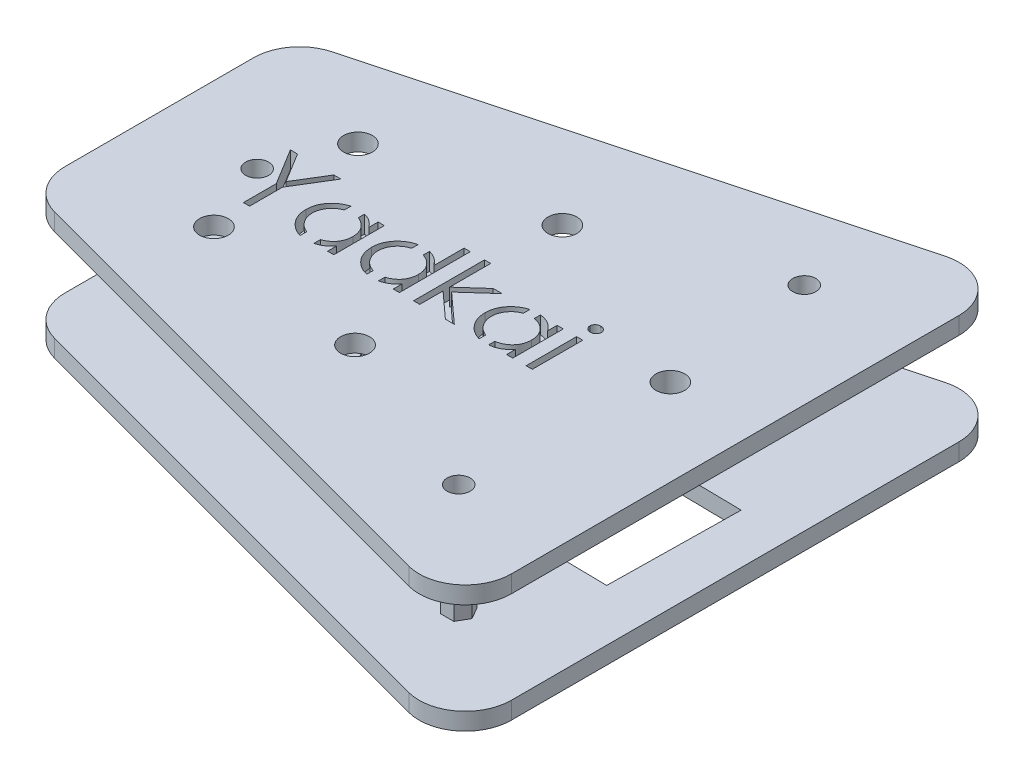
from build123d import *

# Parameters (mm, degrees)
CROQUIS1_R                = 2.5
CROQUIS1_R_2              = 2
SALIENTE_EXTRUIR1_DEPTH   = 22
CROQUIS2_W                = 100
CROQUIS2_H                = 16
CORTAR_EXTRUIR1_DEPTH     = 50
SALIENTE_EXTRUIR2_DEPTH   = 16
SALIENTE_EXTRUIR2_2_DEPTH = 16
SALIENTE_EXTRUIR2_3_DEPTH = 16
SKETCH1_W                 = 1.076923076
SKETCH1_H                 = 8.769230769
CUT_EXTRUDE1_DEPTH        = 30
SKETCH2_W                 = 2.378168238
SKETCH2_H                 = 15.826158804
SKETCH2_W_2               = 2.017947427
SKETCH2_W_3               = 1.737170199
BOSS_EXTRUDE1_DEPTH       = 3
SKETCH3_W                 = 1.391698598
SKETCH3_H                 = 15.836770953
SKETCH3_W_2               = 2.136320855
SKETCH3_H_2               = 18.046858211
SKETCH3_W_3               = 2.14238319
SKETCH3_H_3               = 19.504207353
BOSS_EXTRUDE2_DEPTH       = 3
CUT_EXTRUDE4_DEPTH        = 3
SKETCH11_R                = 9.688361484
BOSS_EXTRUDE3_DEPTH       = 7
SKETCH5_R                 = 2.494533749
CUT_EXTRUDE3_DEPTH        = 23
FILLET2_R                 = 0.7


with BuildPart() as part:
    # Croquis1 → Saliente-Extruir1 (new body)
    with BuildSketch(Plane(origin=(0, 0, 0), x_dir=(1, 0, 0), z_dir=(0, 1, 0))):
        with BuildLine():
            Line((0, 16.361384096), (0, -16.361384096))
            ThreePointArc((0, -16.361384096), (1.653173278, -21.231475528), (5.929447639, -24.088790706))
            Line((5.929447639, -24.088790706), (89.929447639, -46.596522871))
            ThreePointArc((89.929447639, -46.596522871), (96.870091432, -45.215942983), (100, -38.86911626))
            Line((100, -38.86911626), (100, 38.86911626))
            ThreePointArc((100, 38.86911626), (96.870091432, 45.215942983), (89.929447639, 46.596522871))
            Line((89.929447639, 46.596522871), (5.929447639, 24.088790706))
            ThreePointArc((5.929447639, 24.088790706), (1.653173278, 21.231475528), (0, 16.361384096))
        make_face()
        with Locations((22, 12.5)):
            Circle(CROQUIS1_R, mode=Mode.SUBTRACT)
        with Locations((22, -12.5)):
            Circle(CROQUIS1_R, mode=Mode.SUBTRACT)
        with Locations((52, 18)):
            Circle(CROQUIS1_R, mode=Mode.SUBTRACT)
        with Locations((52, -18)):
            Circle(CROQUIS1_R, mode=Mode.SUBTRACT)
        with Locations((17, 0)):
            Circle(CROQUIS1_R_2, mode=Mode.SUBTRACT)
        with Locations((82, -30)):
            Circle(CROQUIS1_R_2, mode=Mode.SUBTRACT)
        with Locations((82, 30)):
            Circle(CROQUIS1_R_2, mode=Mode.SUBTRACT)
    extrude(amount=SALIENTE_EXTRUIR1_DEPTH)

    # Croquis2 → Cortar-Extruir1 (cut, symmetric)
    with BuildSketch(Plane.XY):
        with Locations((50, 11)):
            Rectangle(CROQUIS2_W, CROQUIS2_H)
    extrude(amount=CORTAR_EXTRUIR1_DEPTH, both=True, mode=Mode.SUBTRACT)


with BuildPart() as cortar_extruir1_piece_1:
    # of the separate pieces the step leaves, piece 1, a body of its own (cortar_extruir1_pieces)
    add(part.part.solids().sort_by_distance((89.929447639, 0, -46.596522871))[0])


with BuildPart() as cortar_extruir1_piece_2:
    # of the separate pieces the step leaves, piece 2, a body of its own (cortar_extruir1_pieces)
    add(part.part.solids().sort_by_distance((5.929447639, 19, -24.088790706))[0])


with BuildPart() as body_3:
    # Croquis3 → Saliente-Extruir2 (new body)
    with BuildSketch(Plane(origin=(0, 3, 0), x_dir=(1, 0, 0), z_dir=(0, 1, 0))):
        Polygon((17, -2.309401077), (19, -1.154700538), (19, 1.154700538), (17, 2.309401077), (15, 1.154700538), (15, -1.154700538), align=None)
    extrude(amount=SALIENTE_EXTRUIR2_DEPTH)


with BuildPart() as body_4:
    # Croquis3 → Saliente-Extruir2 2 (new body)
    with BuildSketch(Plane(origin=(0, 3, 0), x_dir=(1, 0, 0), z_dir=(0, 1, 0))):
        Polygon((80.845299462, -32), (83.154700538, -32), (84.309401077, -30), (83.154700538, -28), (80.845299462, -28), (79.690598923, -30), align=None)
    extrude(amount=SALIENTE_EXTRUIR2_2_DEPTH)


with BuildPart() as body_5:
    # Croquis3 → Saliente-Extruir2 3 (new body)
    with BuildSketch(Plane(origin=(0, 3, 0), x_dir=(1, 0, 0), z_dir=(0, 1, 0))):
        Polygon((84, 28.845299462), (84, 31.154700538), (82, 32.309401077), (80, 31.154700538), (80, 28.845299462), (82, 27.690598923), align=None)
    extrude(amount=SALIENTE_EXTRUIR2_3_DEPTH)


with BuildPart() as cut_extrude1_tool:
    # Sketch1 → Cut-Extrude1 (new body)
    # profile 1 of 7: a face of its own
    with BuildSketch(Plane(origin=(0, 22, 0), x_dir=(1, 0, 0), z_dir=(0, 1, 0))):
        Polygon((17.057483242, 5.717152356), (18.290656319, 5.717152356), (21.444502473, 0.560902356), (24.593540935, 5.717152356), (25.826714012, 5.717152356), (21.980560166, -0.578520721), (21.980560166, -6.282847644), (20.903637089, -6.282847644), (20.903637089, -0.578520721), align=None)
    # profile 2 of 7: a face of its own
    with BuildSketch(Plane(origin=(0, 22, 0), x_dir=(1, 0, 0), z_dir=(0, 1, 0))):
        with BuildLine():
            Line((36.595944781, 2.486383125), (36.595944781, -6.282847644))
            Line((36.595944781, -6.282847644), (35.519021704, -6.282847644))
            Line((35.519021704, -6.282847644), (35.519021704, -4.766020721))
            add(Edge.make_bspline(
                [(35.519021704, -4.766020721), (35.39758585, -4.903299329), (35.160602255, -5.171200259), (34.764804136, -5.521196279), (34.345256098, -5.810493381), (33.903994425, -6.044150235), (33.441417591, -6.219665857), (32.958551006, -6.344418402), (32.4551977, -6.424625837), (32.111475341, -6.432635055), (31.937290935, -6.436693798)],
                knots=[0, 0, 0, 0, 1.074387032, 2.096679803, 3.090159297, 4.057316773, 5.018401886, 5.985159533, 6.978961417, 8, 8, 8, 8], degree=3))
            add(Edge.make_bspline(
                [(31.937290935, -6.436693798), (31.782429379, -6.432489093), (31.477035533, -6.424197229), (31.027792983, -6.359869331), (30.595476699, -6.256564342), (30.179678165, -6.11290415), (29.783087952, -5.922341333), (29.402310477, -5.694199911), (29.03931839, -5.422517065), (28.699644543, -5.111929539), (28.386849113, -4.774575298), (28.112353321, -4.414761994), (27.883485618, -4.034045523), (27.692102485, -3.637246139), (27.544686447, -3.221309272), (27.4419197, -2.787673267), (27.37766674, -2.336850844), (27.369378304, -2.029858193), (27.36517555, -1.874193798)],
                knots=[0, 0, 0, 0, 1.033919861, 2.038935746, 3.024066025, 3.998881131, 4.97069526, 5.957263378, 6.95902576, 7.993208707, 9.027059324, 10.027763471, 11.009749337, 11.988697705, 12.965288445, 13.950418724, 14.960734635, 16, 16, 16, 16], degree=3))
            add(Edge.make_bspline(
                [(27.36517555, -1.874193798), (27.369471452, -1.721746815), (27.377964218, -1.420367352), (27.441232401, -0.977126102), (27.54762443, -0.550206351), (27.696931337, -0.140982545), (27.888389468, 0.251040484), (28.121285766, 0.626139998), (28.395637051, 0.985349361), (28.711931018, 1.320222139), (29.054564516, 1.629549959), (29.421108736, 1.898380972), (29.8024457, 2.130553025), (30.204490308, 2.314507801), (30.62129181, 2.463339017), (31.056560767, 2.566309193), (31.50848618, 2.626985723), (31.815310724, 2.635772343), (31.970944781, 2.640229279)],
                knots=[0, 0, 0, 0, 1.020392517, 2.01726096, 2.990465484, 3.961182959, 4.928053699, 5.906110375, 6.912531644, 7.948652711, 8.985773172, 9.998621852, 10.987621588, 11.969261332, 12.953316658, 13.946091881, 14.958173133, 16, 16, 16, 16], degree=3))
            add(Edge.make_bspline(
                [(31.970944781, 2.640229279), (32.149915726, 2.635299845), (32.500869303, 2.625633458), (33.014222478, 2.545189821), (33.499860688, 2.409286505), (33.961532752, 2.224426512), (34.397580819, 1.978773726), (34.803876765, 1.668899574), (35.184672708, 1.296758362), (35.405405136, 1.010916838), (35.519021704, 0.863786971)],
                knots=[0, 0, 0, 0, 1.038897134, 2.037228247, 3.008116434, 3.962042015, 4.918381754, 5.904844433, 6.921570401, 8, 8, 8, 8], degree=3))
            Line((35.519021704, 0.863786971), (35.519021704, 2.486383125))
            Line((35.519021704, 2.486383125), (36.595944781, 2.486383125))
        make_face()
        with BuildLine():
            add(Edge.make_bspline(
                [(31.985367858, 1.563306202), (31.827947271, 1.557705158), (31.517224071, 1.546649589), (31.061073207, 1.460340462), (30.624570073, 1.316736139), (30.209897818, 1.120341049), (29.82360679, 0.873385381), (29.478371347, 0.574683495), (29.171367799, 0.232385161), (28.913168036, -0.151964932), (28.702686332, -0.564004101), (28.55468508, -0.99471646), (28.457076232, -1.436333526), (28.447104161, -1.735862735), (28.442098627, -1.886213029)],
                knots=[0, 0, 0, 0, 1.031046209, 2.035121221, 3.029706178, 4.034933723, 5.034054252, 6.02443088, 7.017295772, 8.038157696, 9.050218397, 10.03989886, 11.016116709, 12, 12, 12, 12], degree=3))
            add(Edge.make_bspline(
                [(28.442098627, -1.886213029), (28.448492547, -2.035664825), (28.461255325, -2.333982617), (28.552971991, -2.776201737), (28.706845843, -3.207015596), (28.91681863, -3.622767573), (29.1797442, -4.008770203), (29.484505295, -4.35759348), (29.834049116, -4.657557783), (30.22122914, -4.908658035), (30.634742182, -5.111500964), (31.069601375, -5.2526403), (31.517632135, -5.343764119), (31.822268708, -5.35440804), (31.975752473, -5.359770721)],
                knots=[0, 0, 0, 0, 0.979072187, 1.954306742, 2.945804271, 3.96968567, 4.997920485, 5.998718438, 6.996577872, 8.005894225, 9.015743152, 10.005417472, 10.995077863, 12, 12, 12, 12], degree=3))
            add(Edge.make_bspline(
                [(31.975752473, -5.359770721), (32.131569054, -5.354079416), (32.441472779, -5.342759976), (32.898976921, -5.256081352), (33.34295965, -5.112874043), (33.767373005, -4.914362751), (34.162742597, -4.668337531), (34.517592463, -4.380313219), (34.817647212, -4.045330874), (35.072021873, -3.677183035), (35.271480445, -3.273599047), (35.416769791, -2.843881821), (35.502668896, -2.388016399), (35.513495398, -2.076482935), (35.519021704, -1.917463029)],
                knots=[0, 0, 0, 0, 1.01762866, 2.023962475, 3.030623092, 4.058876274, 5.077231937, 6.066672613, 7.034107872, 8.005628644, 8.981990164, 9.965428785, 10.961468474, 12, 12, 12, 12], degree=3))
            add(Edge.make_bspline(
                [(35.519021704, -1.917463029), (35.515731454, -1.796304753), (35.5092552, -1.557826924), (35.459778961, -1.207675436), (35.381076356, -0.872588375), (35.270175202, -0.552213441), (35.124490798, -0.24832196), (34.948784172, 0.041268075), (34.739965488, 0.315050514), (34.501396244, 0.569255329), (34.240258406, 0.801117485), (33.963934267, 1.008080597), (33.669149992, 1.178099246), (33.360863008, 1.318812177), (33.038538433, 1.430786405), (32.699553451, 1.505487069), (32.34751121, 1.556779599), (32.107353306, 1.561107761), (31.985367858, 1.563306202)],
                knots=[0, 0, 0, 0, 1.050140795, 2.067009409, 3.05949893, 4.030605086, 5.00011959, 5.97591094, 6.962425594, 7.979863591, 8.993523472, 9.986985069, 10.967611495, 11.937549037, 12.921786183, 13.919465291, 14.943216303, 16, 16, 16, 16], degree=3))
        make_face(mode=Mode.SUBTRACT)
    # profile 3 of 7: a face of its own
    with BuildSketch(Plane(origin=(0, 22, 0), x_dir=(1, 0, 0), z_dir=(0, 1, 0))):
        with BuildLine():
            Line((47.980560166, 6.024844663), (47.980560166, -6.282847644))
            Line((47.980560166, -6.282847644), (46.903637089, -6.282847644))
            Line((46.903637089, -6.282847644), (46.903637089, -4.766020721))
            add(Edge.make_bspline(
                [(46.903637089, -4.766020721), (46.782201235, -4.903299329), (46.54521764, -5.171200259), (46.149419521, -5.521196279), (45.729871482, -5.810493381), (45.28860981, -6.044150235), (44.826032976, -6.219665857), (44.343166391, -6.344418402), (43.839813085, -6.424625837), (43.496090726, -6.432635055), (43.321906319, -6.436693798)],
                knots=[0, 0, 0, 0, 1.074387032, 2.096679803, 3.090159297, 4.057316773, 5.018401886, 5.985159533, 6.978961417, 8, 8, 8, 8], degree=3))
            add(Edge.make_bspline(
                [(43.321906319, -6.436693798), (43.167044763, -6.432489093), (42.861650918, -6.424197229), (42.412408368, -6.359869331), (41.980092084, -6.256564342), (41.564293549, -6.11290415), (41.167703336, -5.922341333), (40.786925862, -5.694199911), (40.423933775, -5.422517065), (40.084259927, -5.111929539), (39.771464497, -4.774575298), (39.496968705, -4.414761994), (39.268101003, -4.034045523), (39.076717869, -3.637246139), (38.929301831, -3.221309272), (38.826535085, -2.787673267), (38.762282125, -2.336850844), (38.753993688, -2.029858193), (38.749790935, -1.874193798)],
                knots=[0, 0, 0, 0, 1.033919861, 2.038935746, 3.024066025, 3.998881131, 4.97069526, 5.957263378, 6.95902576, 7.993208707, 9.027059324, 10.027763471, 11.009749337, 11.988697705, 12.965288445, 13.950418724, 14.960734635, 16, 16, 16, 16], degree=3))
            add(Edge.make_bspline(
                [(38.749790935, -1.874193798), (38.754086837, -1.721746815), (38.762579603, -1.420367352), (38.825847785, -0.977126102), (38.932239815, -0.550206351), (39.081546721, -0.140982545), (39.273004853, 0.251040484), (39.505901151, 0.626139998), (39.780252436, 0.985349361), (40.096546402, 1.320222139), (40.4391799, 1.629549959), (40.80572412, 1.898380972), (41.187061085, 2.130553025), (41.589105692, 2.314507801), (42.005907195, 2.463339017), (42.441176152, 2.566309193), (42.893101564, 2.626985723), (43.199926108, 2.635772343), (43.355560166, 2.640229279)],
                knots=[0, 0, 0, 0, 1.020392517, 2.01726096, 2.990465484, 3.961182959, 4.928053699, 5.906110375, 6.912531644, 7.948652711, 8.985773172, 9.998621852, 10.987621588, 11.969261332, 12.953316658, 13.946091881, 14.958173133, 16, 16, 16, 16], degree=3))
            add(Edge.make_bspline(
                [(43.355560166, 2.640229279), (43.534589221, 2.634856378), (43.88600336, 2.624309971), (44.399941148, 2.536173856), (44.886070098, 2.388186846), (45.347188913, 2.185588167), (45.780548548, 1.922271306), (46.189325601, 1.604266342), (46.56641128, 1.222573269), (46.789514671, 0.935905017), (46.903637089, 0.78926774)],
                knots=[0, 0, 0, 0, 1.031072012, 2.023879775, 2.993683497, 3.952812103, 4.918022106, 5.908088563, 6.929940113, 8, 8, 8, 8], degree=3))
            Line((46.903637089, 0.78926774), (46.903637089, 6.024844663))
            Line((46.903637089, 6.024844663), (47.980560166, 6.024844663))
        make_face()
        with BuildLine():
            add(Edge.make_bspline(
                [(43.369983242, 1.563306202), (43.212562655, 1.557705158), (42.901839456, 1.546649589), (42.445688591, 1.460340462), (42.009185457, 1.316736139), (41.594513203, 1.120341049), (41.208222174, 0.873385381), (40.862986731, 0.574683495), (40.555983184, 0.232385161), (40.297783421, -0.151964932), (40.087301717, -0.564004101), (39.939300465, -0.99471646), (39.841691616, -1.436333526), (39.831719546, -1.735862735), (39.826714012, -1.886213029)],
                knots=[0, 0, 0, 0, 1.031046209, 2.035121221, 3.029706178, 4.034933723, 5.034054252, 6.02443088, 7.017295772, 8.038157696, 9.050218397, 10.03989886, 11.016116709, 12, 12, 12, 12], degree=3))
            add(Edge.make_bspline(
                [(39.826714012, -1.886213029), (39.833107932, -2.035664825), (39.845870709, -2.333982617), (39.937587376, -2.776201737), (40.091461228, -3.207015596), (40.301434014, -3.622767573), (40.564359585, -4.008770203), (40.869120679, -4.35759348), (41.218664501, -4.657557783), (41.605844525, -4.908658035), (42.019357566, -5.111500964), (42.45421676, -5.2526403), (42.902247519, -5.343764119), (43.206884093, -5.35440804), (43.360367858, -5.359770721)],
                knots=[0, 0, 0, 0, 0.979072187, 1.954306742, 2.945804271, 3.96968567, 4.997920485, 5.998718438, 6.996577872, 8.005894225, 9.015743152, 10.005417472, 10.995077863, 12, 12, 12, 12], degree=3))
            add(Edge.make_bspline(
                [(43.360367858, -5.359770721), (43.516184439, -5.354079416), (43.826088164, -5.342759976), (44.283592305, -5.256081352), (44.727575035, -5.112874043), (45.151988389, -4.914362751), (45.547357982, -4.668337531), (45.902207848, -4.380313219), (46.202262597, -4.045330874), (46.456637258, -3.677183035), (46.65609583, -3.273599047), (46.801385175, -2.843881821), (46.887284281, -2.388016399), (46.898110783, -2.076482935), (46.903637089, -1.917463029)],
                knots=[0, 0, 0, 0, 1.01762866, 2.023962475, 3.030623092, 4.058876274, 5.077231937, 6.066672613, 7.034107872, 8.005628644, 8.981990164, 9.965428785, 10.961468474, 12, 12, 12, 12], degree=3))
            add(Edge.make_bspline(
                [(46.903637089, -1.917463029), (46.900346838, -1.796304753), (46.893870584, -1.557826924), (46.844394346, -1.207675436), (46.765691741, -0.872588375), (46.654790587, -0.552213441), (46.509106183, -0.24832196), (46.333399557, 0.041268075), (46.124580872, 0.315050514), (45.886011628, 0.569255329), (45.624873791, 0.801117485), (45.348549652, 1.008080597), (45.053765376, 1.178099246), (44.745478393, 1.318812177), (44.423153817, 1.430786405), (44.084168835, 1.505487069), (43.732126594, 1.556779599), (43.49196869, 1.561107761), (43.369983242, 1.563306202)],
                knots=[0, 0, 0, 0, 1.050140795, 2.067009409, 3.05949893, 4.030605086, 5.00011959, 5.97591094, 6.962425594, 7.979863591, 8.993523472, 9.986985069, 10.967611495, 11.937549037, 12.921786183, 13.919465291, 14.943216303, 16, 16, 16, 16], degree=3))
        make_face(mode=Mode.SUBTRACT)
    # profile 4 of 7: a face of its own
    with BuildSketch(Plane(origin=(0, 22, 0), x_dir=(1, 0, 0), z_dir=(0, 1, 0))):
        Polygon((50.442098627, 6.024844663), (51.519021704, 6.024844663), (51.519021704, -1.090539952), (55.509406319, 2.486383125), (57.057483242, 2.486383125), (52.42767555, -1.667463029), (57.519021704, -6.282847644), (55.973348627, -6.282847644), (51.519021704, -2.24198226), (51.519021704, -6.282847644), (50.442098627, -6.282847644), align=None)
    # profile 5 of 7: a face of its own
    with BuildSketch(Plane(origin=(0, 22, 0), x_dir=(1, 0, 0), z_dir=(0, 1, 0))):
        with BuildLine():
            Line((67.672867858, 2.486383125), (67.672867858, -6.282847644))
            Line((67.672867858, -6.282847644), (66.595944781, -6.282847644))
            Line((66.595944781, -6.282847644), (66.595944781, -4.766020721))
            add(Edge.make_bspline(
                [(66.595944781, -4.766020721), (66.474508927, -4.903299329), (66.237525332, -5.171200259), (65.841727213, -5.521196279), (65.422179175, -5.810493381), (64.980917502, -6.044150235), (64.518340668, -6.219665857), (64.035474083, -6.344418402), (63.532120777, -6.424625837), (63.188398418, -6.432635055), (63.014214012, -6.436693798)],
                knots=[0, 0, 0, 0, 1.074387032, 2.096679803, 3.090159297, 4.057316773, 5.018401886, 5.985159533, 6.978961417, 8, 8, 8, 8], degree=3))
            add(Edge.make_bspline(
                [(63.014214012, -6.436693798), (62.859352456, -6.432489093), (62.55395861, -6.424197229), (62.10471606, -6.359869331), (61.672399776, -6.256564342), (61.256601241, -6.11290415), (60.860011029, -5.922341333), (60.479233554, -5.694199911), (60.116241467, -5.422517065), (59.776567619, -5.111929539), (59.46377219, -4.774575298), (59.189276398, -4.414761994), (58.960408695, -4.034045523), (58.769025562, -3.637246139), (58.621609523, -3.221309272), (58.518842777, -2.787673267), (58.454589817, -2.336850844), (58.446301381, -2.029858193), (58.442098627, -1.874193798)],
                knots=[0, 0, 0, 0, 1.033919861, 2.038935746, 3.024066025, 3.998881131, 4.97069526, 5.957263378, 6.95902576, 7.993208707, 9.027059324, 10.027763471, 11.009749337, 11.988697705, 12.965288445, 13.950418724, 14.960734635, 16, 16, 16, 16], degree=3))
            add(Edge.make_bspline(
                [(58.442098627, -1.874193798), (58.446394529, -1.721746815), (58.454887295, -1.420367352), (58.518155478, -0.977126102), (58.624547507, -0.550206351), (58.773854414, -0.140982545), (58.965312545, 0.251040484), (59.198208843, 0.626139998), (59.472560128, 0.985349361), (59.788854095, 1.320222139), (60.131487592, 1.629549959), (60.498031813, 1.898380972), (60.879368777, 2.130553025), (61.281413385, 2.314507801), (61.698214887, 2.463339017), (62.133483844, 2.566309193), (62.585409256, 2.626985723), (62.892233801, 2.635772343), (63.047867858, 2.640229279)],
                knots=[0, 0, 0, 0, 1.020392517, 2.01726096, 2.990465484, 3.961182959, 4.928053699, 5.906110375, 6.912531644, 7.948652711, 8.985773172, 9.998621852, 10.987621588, 11.969261332, 12.953316658, 13.946091881, 14.958173133, 16, 16, 16, 16], degree=3))
            add(Edge.make_bspline(
                [(63.047867858, 2.640229279), (63.226838803, 2.635299845), (63.57779238, 2.625633458), (64.091145555, 2.545189821), (64.576783765, 2.409286505), (65.038455829, 2.224426512), (65.474503896, 1.978773726), (65.880799842, 1.668899574), (66.261595785, 1.296758362), (66.482328213, 1.010916838), (66.595944781, 0.863786971)],
                knots=[0, 0, 0, 0, 1.038897134, 2.037228247, 3.008116434, 3.962042015, 4.918381754, 5.904844433, 6.921570401, 8, 8, 8, 8], degree=3))
            Line((66.595944781, 0.863786971), (66.595944781, 2.486383125))
            Line((66.595944781, 2.486383125), (67.672867858, 2.486383125))
        make_face()
        with BuildLine():
            add(Edge.make_bspline(
                [(63.062290935, 1.563306202), (62.904870348, 1.557705158), (62.594147148, 1.546649589), (62.137996284, 1.460340462), (61.70149315, 1.316736139), (61.286820895, 1.120341049), (60.900529867, 0.873385381), (60.555294424, 0.574683495), (60.248290876, 0.232385161), (59.990091113, -0.151964932), (59.779609409, -0.564004101), (59.631608157, -0.99471646), (59.533999309, -1.436333526), (59.524027238, -1.735862735), (59.519021704, -1.886213029)],
                knots=[0, 0, 0, 0, 1.031046209, 2.035121221, 3.029706178, 4.034933723, 5.034054252, 6.02443088, 7.017295772, 8.038157696, 9.050218397, 10.03989886, 11.016116709, 12, 12, 12, 12], degree=3))
            add(Edge.make_bspline(
                [(59.519021704, -1.886213029), (59.525415624, -2.035664825), (59.538178402, -2.333982617), (59.629895068, -2.776201737), (59.78376892, -3.207015596), (59.993741707, -3.622767573), (60.256667277, -4.008770203), (60.561428371, -4.35759348), (60.910972193, -4.657557783), (61.298152217, -4.908658035), (61.711665259, -5.111500964), (62.146524452, -5.2526403), (62.594555212, -5.343764119), (62.899191785, -5.35440804), (63.05267555, -5.359770721)],
                knots=[0, 0, 0, 0, 0.979072187, 1.954306742, 2.945804271, 3.96968567, 4.997920485, 5.998718438, 6.996577872, 8.005894225, 9.015743152, 10.005417472, 10.995077863, 12, 12, 12, 12], degree=3))
            add(Edge.make_bspline(
                [(63.05267555, -5.359770721), (63.208492131, -5.354079416), (63.518395856, -5.342759976), (63.975899998, -5.256081352), (64.419882727, -5.112874043), (64.844296082, -4.914362751), (65.239665674, -4.668337531), (65.59451554, -4.380313219), (65.894570289, -4.045330874), (66.14894495, -3.677183035), (66.348403522, -3.273599047), (66.493692868, -2.843881821), (66.579591973, -2.388016399), (66.590418475, -2.076482935), (66.595944781, -1.917463029)],
                knots=[0, 0, 0, 0, 1.01762866, 2.023962475, 3.030623092, 4.058876274, 5.077231937, 6.066672613, 7.034107872, 8.005628644, 8.981990164, 9.965428785, 10.961468474, 12, 12, 12, 12], degree=3))
            add(Edge.make_bspline(
                [(66.595944781, -1.917463029), (66.59265453, -1.796304753), (66.586178276, -1.557826924), (66.536702038, -1.207675436), (66.457999433, -0.872588375), (66.347098279, -0.552213441), (66.201413875, -0.24832196), (66.025707249, 0.041268075), (65.816888564, 0.315050514), (65.578319321, 0.569255329), (65.317181483, 0.801117485), (65.040857344, 1.008080597), (64.746073069, 1.178099246), (64.437786085, 1.318812177), (64.11546151, 1.430786405), (63.776476528, 1.505487069), (63.424434287, 1.556779599), (63.184276382, 1.561107761), (63.062290935, 1.563306202)],
                knots=[0, 0, 0, 0, 1.050140795, 2.067009409, 3.05949893, 4.030605086, 5.00011959, 5.97591094, 6.962425594, 7.979863591, 8.993523472, 9.986985069, 10.967611495, 11.937549037, 12.921786183, 13.919465291, 14.943216303, 16, 16, 16, 16], degree=3))
        make_face(mode=Mode.SUBTRACT)
    # profile 6 of 7: a face of its own
    with BuildSketch(Plane(origin=(0, 22, 0), x_dir=(1, 0, 0), z_dir=(0, 1, 0))):
        with BuildLine():
            add(Edge.make_bspline(
                [(70.514214012, 6.178690817), (70.58104138, 6.175590866), (70.711902202, 6.169520566), (70.901136263, 6.117538359), (71.073446019, 6.029425152), (71.22628396, 5.911209103), (71.357433286, 5.77218244), (71.449252864, 5.610144834), (71.508266794, 5.435086644), (71.515393269, 5.312977767), (71.519021704, 5.250806202)],
                knots=[0, 0, 0, 0, 1.055194115, 2.066272739, 3.074728998, 4.095836921, 5.109056067, 6.073838105, 7.019297344, 8, 8, 8, 8], degree=3))
            add(Edge.make_bspline(
                [(71.519021704, 5.250806202), (71.515311442, 5.190248534), (71.507976692, 5.070533191), (71.449298447, 4.898509858), (71.356650774, 4.738723743), (71.226368058, 4.599967023), (71.073423734, 4.481816325), (70.901142183, 4.393685792), (70.711900645, 4.341708178), (70.581040854, 4.335637245), (70.514214012, 4.332536971)],
                knots=[0, 0, 0, 0, 0.96129708, 1.900370562, 2.859976407, 3.87933698, 4.906634145, 5.921202961, 6.938410037, 8, 8, 8, 8], degree=3))
            add(Edge.make_bspline(
                [(70.514214012, 4.332536971), (70.448151354, 4.335518869), (70.319569022, 4.341322743), (70.13316842, 4.394705661), (69.962327885, 4.481846484), (69.809191864, 4.599193404), (69.681545488, 4.739575909), (69.588636943, 4.898412345), (69.530094217, 5.070558018), (69.522741205, 5.190256874), (69.519021704, 5.250806202)],
                knots=[0, 0, 0, 0, 1.054934014, 2.053291228, 3.073705704, 4.106921865, 5.123545215, 6.088680038, 7.033164197, 8, 8, 8, 8], degree=3))
            add(Edge.make_bspline(
                [(69.519021704, 5.250806202), (69.522659715, 5.312969115), (69.529804999, 5.435060998), (69.588680826, 5.610243968), (69.680771595, 5.771323403), (69.809276384, 5.911982258), (69.962305391, 6.029395177), (70.133174232, 6.116518542), (70.319567487, 6.169905991), (70.448150833, 6.175709241), (70.514214012, 6.178690817)],
                knots=[0, 0, 0, 0, 0.98631895, 1.937192651, 2.907499808, 3.917963147, 4.944918757, 5.95915025, 6.951458133, 8, 8, 8, 8], degree=3))
        make_face()
    # profile 7 of 7: a face of its own
    with BuildSketch(Plane(origin=(0, 22, 0), x_dir=(1, 0, 0), z_dir=(0, 1, 0))):
        with Locations((70.519021704, -1.89823226)):
            Rectangle(SKETCH1_W, SKETCH1_H)
    extrude(amount=-CUT_EXTRUDE1_DEPTH)


with BuildPart() as cortar_extruir1_piece_1_1:
    add(cortar_extruir1_piece_1.part)

    # Cut-Extrude1: cut by cut_extrude1_tool
    add(cut_extrude1_tool.part, mode=Mode.SUBTRACT)


with BuildPart() as cortar_extruir1_piece_2_1:
    add(cortar_extruir1_piece_2.part)

    # Cut-Extrude1: cut by cut_extrude1_tool
    add(cut_extrude1_tool.part, mode=Mode.SUBTRACT)


with BuildPart() as cut_extrude1_piece_1:
    # of the separate pieces the step leaves, piece 1, a body of its own (cut_extrude1_pieces)
    add(cortar_extruir1_piece_1_1.part.solids().sort_by_distance((89.929447639, 0, -46.596522871))[0])



with BuildPart() as cut_extrude1_piece_2:
    # of the separate pieces the step leaves, piece 2, a body of its own (cut_extrude1_pieces)
    add(cortar_extruir1_piece_1_1.part.solids().sort_by_distance((28.442098627, 0, 1.886213029))[0])


with BuildPart() as cut_extrude1_piece_3:
    # of the separate pieces the step leaves, piece 3, a body of its own (cut_extrude1_pieces)
    add(cortar_extruir1_piece_1_1.part.solids().sort_by_distance((39.826714012, 0, 1.886213029))[0])


with BuildPart() as cut_extrude1_piece_4:
    # of the separate pieces the step leaves, piece 4, a body of its own (cut_extrude1_pieces)
    add(cortar_extruir1_piece_1_1.part.solids().sort_by_distance((59.519021704, 0, 1.886213029))[0])


with BuildPart() as cut_extrude1_piece_1_of_cortar_extruir1:
    # of the separate pieces the step leaves, piece 1, a body of its own (cut_extrude1_pieces_of_cortar_extruir1_p)
    add(cortar_extruir1_piece_2_1.part.solids().sort_by_distance((5.929447639, 19, -24.088790706))[0])



with BuildPart() as cut_extrude1_piece_2_of_cortar_extruir1:
    # of the separate pieces the step leaves, piece 2, a body of its own (cut_extrude1_pieces_of_cortar_extruir1_p)
    add(cortar_extruir1_piece_2_1.part.solids().sort_by_distance((63.05267555, 19, 5.359770721))[0])


with BuildPart() as cut_extrude1_piece_3_of_cortar_extruir1:
    # of the separate pieces the step leaves, piece 3, a body of its own (cut_extrude1_pieces_of_cortar_extruir1_p)
    add(cortar_extruir1_piece_2_1.part.solids().sort_by_distance((31.975752473, 19, 5.359770721))[0])


with BuildPart() as cut_extrude1_piece_4_of_cortar_extruir1:
    # of the separate pieces the step leaves, piece 4, a body of its own (cut_extrude1_pieces_of_cortar_extruir1_p)
    add(cortar_extruir1_piece_2_1.part.solids().sort_by_distance((43.360367858, 19, 5.359770721))[0])


with BuildPart() as cut_extrude1_piece_1_of_cortar_extruir1_1:
    add(cut_extrude1_piece_1_of_cortar_extruir1.part)

    add(cut_extrude1_piece_2_of_cortar_extruir1.part)  # Boss-Extrude1 merges Cut-Extrude1 piece 2 of Cortar-Extruir1

    add(cut_extrude1_piece_3_of_cortar_extruir1.part)  # Boss-Extrude1 merges Cut-Extrude1 piece 3 of Cortar-Extruir1

    add(cut_extrude1_piece_4_of_cortar_extruir1.part)  # Boss-Extrude1 merges Cut-Extrude1 piece 4 of Cortar-Extruir1
    # Sketch2 → Boss-Extrude1 (add)
    with BuildSketch(Plane(origin=(0, 22, 0), x_dir=(1, 0, 0), z_dir=(0, 1, 0))):
        with Locations((31.96579843, -1.748023192)):
            Rectangle(SKETCH2_W, SKETCH2_H)
        with Locations((43.392352608, -1.748023192)):
            Rectangle(SKETCH2_W_2, SKETCH2_H)
        with Locations((62.716618297, -1.748023192)):
            Rectangle(SKETCH2_W_3, SKETCH2_H)
    extrude(amount=-BOSS_EXTRUDE1_DEPTH)

    # Sketch11 → Boss-Extrude3 (add)
    with BuildSketch(Plane(origin=(0, 22, 0), x_dir=(1, 0, 0), z_dir=(0, 1, 0))):
        with Locations((84.971880757, 3.778939904)):
            Circle(SKETCH11_R)
    extrude(amount=-BOSS_EXTRUDE3_DEPTH)

    # Sketch5 → Cut-Extrude3 (cut)
    with BuildSketch(Plane(origin=(0, 22, 0), x_dir=(1, 0, 0), z_dir=(0, 1, 0))):
        with Locations((84.971880757, 3.778939904)):
            Circle(SKETCH5_R)
    extrude(amount=-CUT_EXTRUDE3_DEPTH, mode=Mode.SUBTRACT)

    # Fillet2
    fillet2_edges = [cut_extrude1_piece_1_of_cortar_extruir1_1.edges().sort_by_distance(p)[0] for p in [
        (75.283519273, 15, -3.778939904),
    ]]
    fillet(fillet2_edges, radius=FILLET2_R)


with BuildPart() as cut_extrude1_piece_1_1:
    add(cut_extrude1_piece_1.part)

    add(cut_extrude1_piece_2.part)  # Boss-Extrude2 merges Cut-Extrude1 piece 2

    add(cut_extrude1_piece_3.part)  # Boss-Extrude2 merges Cut-Extrude1 piece 3

    add(cut_extrude1_piece_4.part)  # Boss-Extrude2 merges Cut-Extrude1 piece 4
    # Sketch3 → Boss-Extrude2 (add)
    with BuildSketch(Plane(origin=(0, 0, 0), x_dir=(-1, 0, 0), z_dir=(0, -1, 0))):
        with Locations((-31.858565735, -2.148219344)):
            Rectangle(SKETCH3_W, SKETCH3_H)
        with Locations((-43.419735977, -1.043175714)):
            Rectangle(SKETCH3_W_2, SKETCH3_H_2)
        with Locations((-63.113924776, -1.771850285)):
            Rectangle(SKETCH3_W_3, SKETCH3_H_3)
    extrude(amount=-BOSS_EXTRUDE2_DEPTH)

    # Sketch6 → Cut-Extrude4 (cut)
    with BuildSketch(Plane(origin=(0, 0, 0), x_dir=(-1, 0, 0), z_dir=(0, -1, 0))):
        Polygon((-91.012249468, -13.315034058), (-78.41371075, -13.12314299), (-78.763988097, 9.87418959), (-91.362526815, 9.682298521), align=None)
    extrude(amount=-CUT_EXTRUDE4_DEPTH, mode=Mode.SUBTRACT)


solid = Compound([body_3.part, body_4.part, body_5.part, cut_extrude1_piece_1_of_cortar_extruir1_1.part, cut_extrude1_piece_1_1.part])
